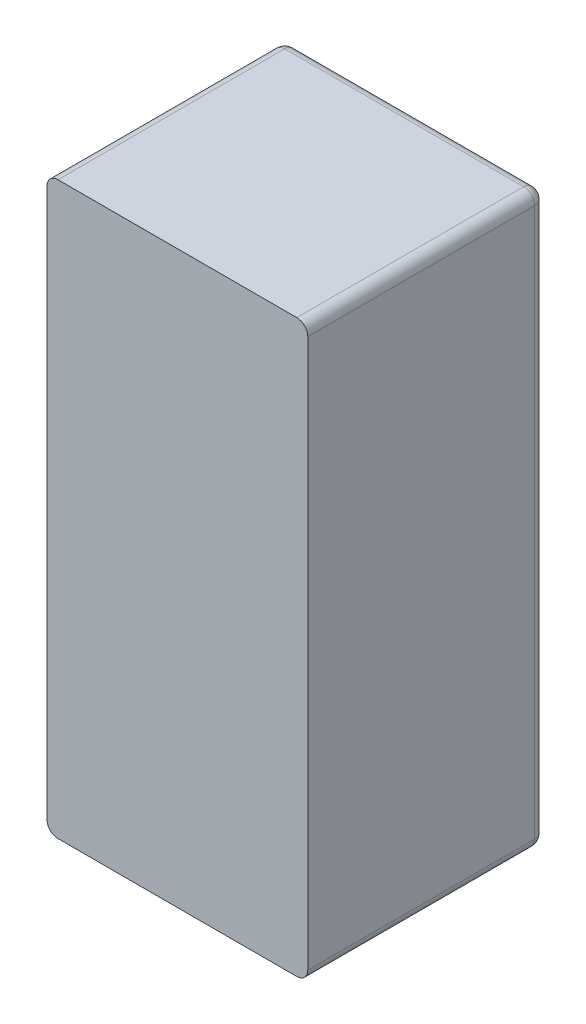
from build123d import *

# Parameters (mm, degrees)
SKETCH1_W           = 237.998
SKETCH1_H           = 216.916
BOSS_EXTRUDE1_DEPTH = 520.7
FILLET1_R           = 10


with BuildPart() as part:
    # Sketch1 → Boss-Extrude1 (new body)
    with BuildSketch(Plane(origin=(0, 0, 0), x_dir=(1, 0, 0), z_dir=(0, 1, 0))):
        with Locations((-118.999, -108.458)):
            Rectangle(SKETCH1_W, SKETCH1_H)
    extrude(amount=BOSS_EXTRUDE1_DEPTH)

    # Fillet1
    fillet1_edges = [part.edges().sort_by_distance(p)[0] for p in [
        (0, 260.35, 0),
        (-118.999, 520.7, 0),
        (-237.998, 260.35, 0),
        (-118.999, 0, 0),
        (-237.998, 520.7, 108.458),
        (-237.998, 0, 108.458),
        (0, 520.7, 108.458),
        (0, 0, 108.458),
    ]]
    fillet(fillet1_edges, radius=FILLET1_R)


solid = part.part
